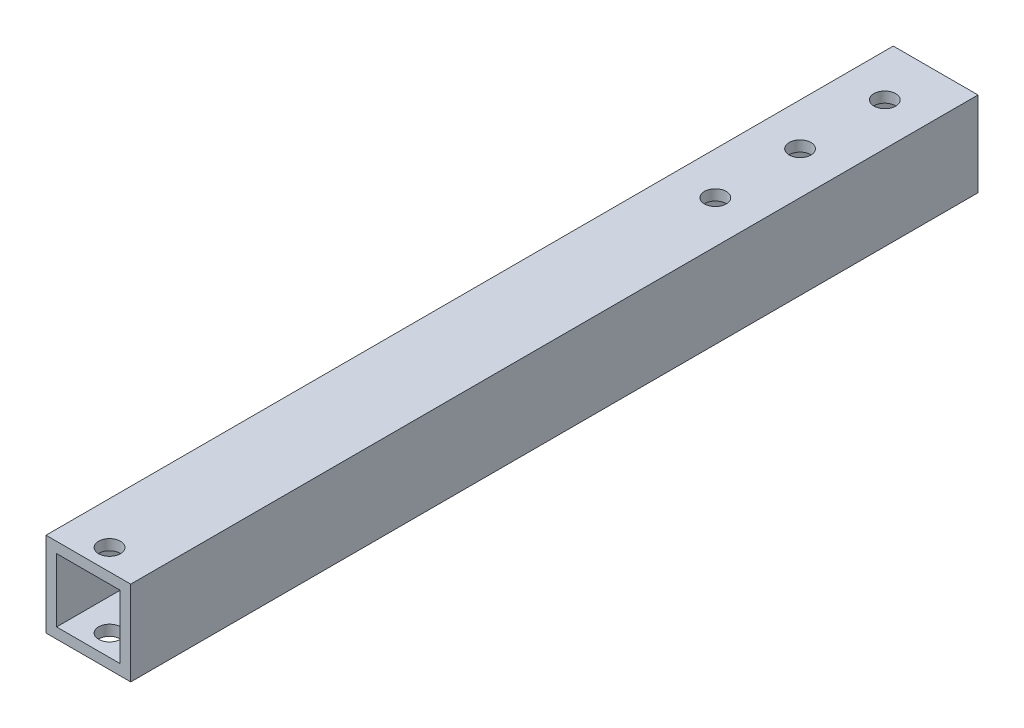
from build123d import *

# Parameters (mm, degrees)
SKETCH2_W           = 25.4
SKETCH2_H           = 25.4
BOSS_EXTRUDE1_DEPTH = 254
SKETCH4_W           = 19.05
SKETCH4_H           = 19.05
CUT_EXTRUDE1_DEPTH  = 255.634208228
SKETCH5_R           = 3.2639
CUT_EXTRUDE2_DEPTH  = 304.8
SKETCH6_R           = 3.2639
CUT_EXTRUDE3_DEPTH  = 256.582569828
SKETCH8_R           = 3.2639
CUT_EXTRUDE4_DEPTH  = 256.582569828


with BuildPart() as part:
    # Sketch2 → Boss-Extrude1 (new body)
    with BuildSketch(Plane.XY):
        Rectangle(SKETCH2_W, SKETCH2_H)
    extrude(amount=BOSS_EXTRUDE1_DEPTH)

    # Sketch4 → Cut-Extrude1 (cut, through all)
    with BuildSketch(Plane.XY):
        Rectangle(SKETCH4_W, SKETCH4_H)
    extrude(amount=CUT_EXTRUDE1_DEPTH, mode=Mode.SUBTRACT)

    # Sketch5 → Cut-Extrude2 (cut)
    with BuildSketch(Plane(origin=(0, 12.7, 0), x_dir=(1, 0, 0), z_dir=(0, 1, 0))):
        with Locations((0, -15.24)):
            Circle(SKETCH5_R)
    extrude(amount=-CUT_EXTRUDE2_DEPTH, mode=Mode.SUBTRACT)

    # Sketch6 → Cut-Extrude3 (cut, through all)
    with BuildSketch(Plane(origin=(0, 12.7, 0), x_dir=(1, 0, 0), z_dir=(0, 1, 0))):
        with Locations((0, -247.65)):
            Circle(SKETCH6_R)
    extrude(amount=-CUT_EXTRUDE3_DEPTH, mode=Mode.SUBTRACT)

    # Sketch8 → Cut-Extrude4 (cut, through all)
    with BuildSketch(Plane(origin=(0, 12.7, 0), x_dir=(1, 0, 0), z_dir=(0, 1, 0))):
        with Locations((0, -66.04)):
            Circle(SKETCH8_R)
        with Locations((0, -40.64)):
            Circle(SKETCH8_R)
    extrude(amount=-CUT_EXTRUDE4_DEPTH, mode=Mode.SUBTRACT)


solid = part.part
